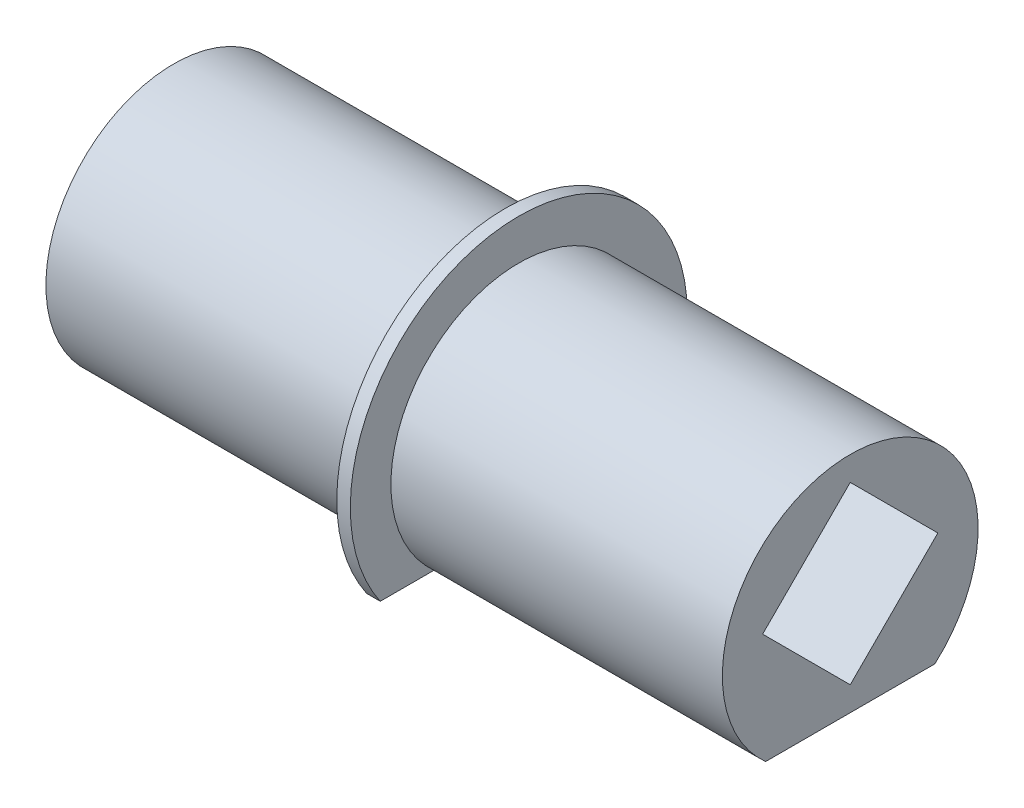
from build123d import *

# Parameters (mm, degrees)
BOSS_EXTRU_1_DEPTH      = 25
BOSS_EXTRU_2_DEPTH      = 0.5
ENL_V_MAT_EXTRU_1_DEPTH = 50


with BuildPart() as part:
    # Esquisse1 → Boss.-Extru.1 (new, symmetric)
    with BuildSketch(Plane(origin=(0, 0, 0), x_dir=(0, 0, -1), z_dir=(1, 0, 0))):
        with BuildLine():
            Line((-6.25232447, -7.085967733), (6.25232447, -7.085967733))
            ThreePointArc((6.25232447, -7.085967733), (0, 9.45), (-6.25232447, -7.085967733))
        make_face()
    extrude(amount=BOSS_EXTRU_1_DEPTH, both=True)

    # Esquisse3 → Boss.-Extru.2 (add, symmetric)
    with BuildSketch(Plane(origin=(0, 0, 0), x_dir=(0, 0, -1), z_dir=(1, 0, 0))):
        with BuildLine():
            Line((-10.236774945, -7.085967733), (10.236774945, -7.085967733))
            ThreePointArc((10.236774945, -7.085967733), (0, 12.45), (-10.236774945, -7.085967733))
        make_face()
    extrude(amount=BOSS_EXTRU_2_DEPTH, both=True)

    # Esquisse2 → Enlèv. mat.-Extru.1 (cut, symmetric)
    with BuildSketch(Plane(origin=(0, 0, 0), x_dir=(0, 0, -1), z_dir=(1, 0, 0))):
        Polygon((-6.475943905, 1.182016133), (0, -5.293927772), (6.475943905, 1.182016133), (0, 7.657960039), align=None)
    extrude(amount=ENL_V_MAT_EXTRU_1_DEPTH, both=True, mode=Mode.SUBTRACT)


solid = part.part
